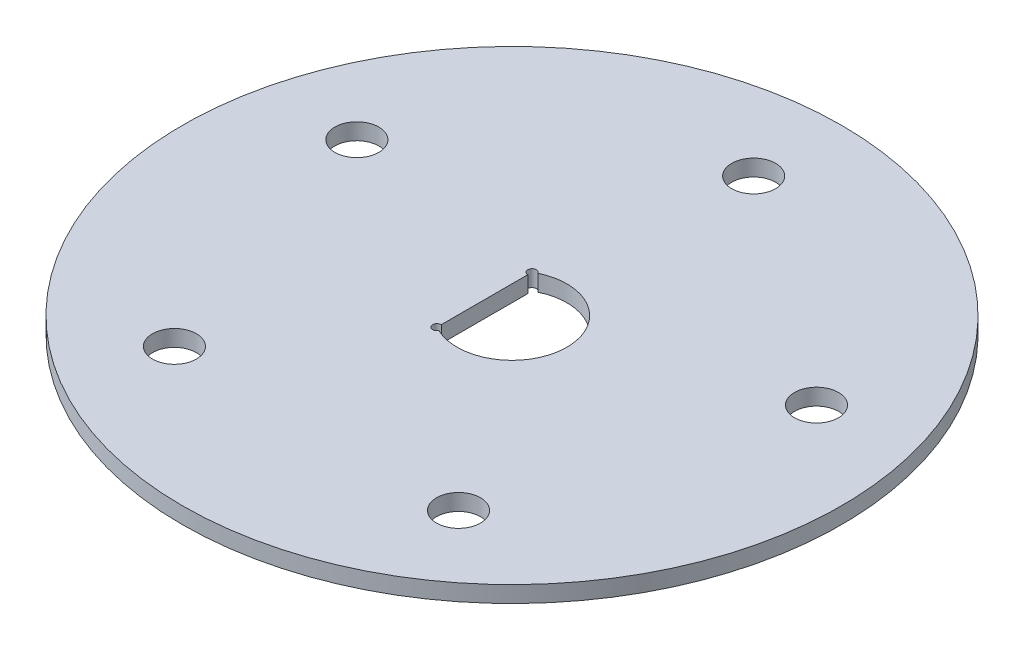
from build123d import *

# Parameters (mm, degrees)
SKETCH1_R               = 38.1
SKETCH1_R_2             = 2.54
BOSS_EXTRUDE1_DEPTH     = 1.89738
CUT_EXTRUDE1_DEPTH      = 54.914933468
CUT_EXTRUDE1_DEPTH_BACK = 54.914933468
SKETCH2_R               = 0.5


with BuildPart() as part:
    # Sketch1 → Boss-Extrude1 (new body)
    with BuildSketch(Plane(origin=(0, 0, 0), x_dir=(1, 0, 0), z_dir=(0, 1, 0))):
        Circle(SKETCH1_R)
        with Locations((0, 27.94)):
            Circle(SKETCH1_R_2, mode=Mode.SUBTRACT)
        with Locations((26.572519065, 8.633934823)):
            Circle(SKETCH1_R_2, mode=Mode.SUBTRACT)
        with Locations((16.422719949, -22.603934823)):
            Circle(SKETCH1_R_2, mode=Mode.SUBTRACT)
        with Locations((-16.422719949, -22.603934823)):
            Circle(SKETCH1_R_2, mode=Mode.SUBTRACT)
        with Locations((-26.572519065, 8.633934823)):
            Circle(SKETCH1_R_2, mode=Mode.SUBTRACT)
        with BuildLine():
            Line((-3.175, 5.499261314), (-3.175, -5.499261314))
            ThreePointArc((-3.175, -5.499261314), (6.35, 0), (-3.175, 5.499261314))
        make_face(mode=Mode.SUBTRACT)
    extrude(amount=BOSS_EXTRUDE1_DEPTH)

    # Sketch2 → Cut-Extrude1 (cut, two sides: drawn at the far end of the back side and taken through both)
    with BuildSketch(Plane(origin=(0, 1.89738, 0), x_dir=(1, 0, 0), z_dir=(0, 1, 0)).offset(-CUT_EXTRUDE1_DEPTH_BACK)):
        with Locations((-3.175, 5.499261314)):
            Circle(SKETCH2_R)
        with Locations((-3.175, -5.499261314)):
            Circle(SKETCH2_R)
    extrude(amount=CUT_EXTRUDE1_DEPTH + CUT_EXTRUDE1_DEPTH_BACK, mode=Mode.SUBTRACT)


solid = part.part
